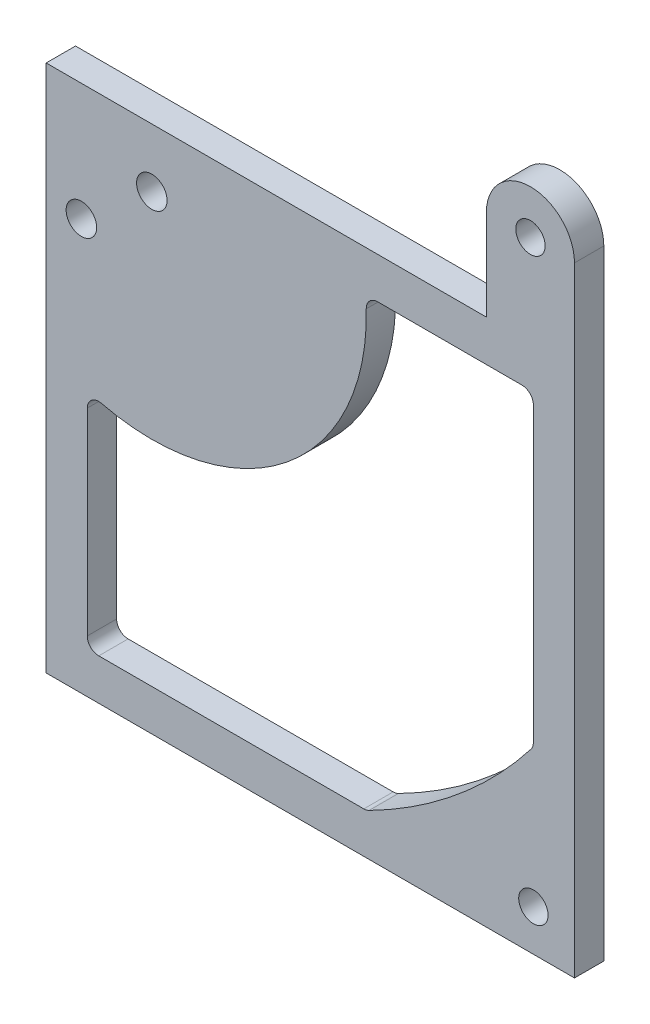
from build123d import *

# Parameters (mm, degrees)
SKETCH1_R           = 3.302
SKETCH1_R_2         = 3.175
BOSS_EXTRUDE1_DEPTH = 3.175


with BuildPart() as part:
    # Sketch1 → Boss-Extrude1 (new, symmetric)
    with BuildSketch(Plane.XY):
        with BuildLine():
            Line((-57.15, -57.15), (57.15, -57.15))
            Line((57.15, -57.15), (57.15, 76.835))
            ThreePointArc((57.15, 76.835), (47.625, 86.36), (38.1, 76.835))
            Line((38.1, 76.835), (38.1, 57.15))
            Line((38.1, 57.15), (-57.15, 57.15))
            Line((-57.15, 57.15), (-57.15, -57.15))
        make_face()
        with Locations((-49.53, 31.75)):
            Circle(SKETCH1_R, mode=Mode.SUBTRACT)
        with Locations((-34.29, 44.45)):
            Circle(SKETCH1_R, mode=Mode.SUBTRACT)
        with Locations((48.26, -48.25058611)):
            Circle(SKETCH1_R_2, mode=Mode.SUBTRACT)
        with Locations((47.625, 76.835)):
            Circle(SKETCH1_R_2, mode=Mode.SUBTRACT)
        with BuildLine():
            Line((-45.77152391, -48.25058611), (11.571822448, -48.25058611))
            ThreePointArc((11.571822448, -48.25058611), (12.151642643, -48.182093861), (12.69954516, -47.980387445))
            ThreePointArc((12.69954516, -47.980387445), (31.830233088, -35.421826409), (47.740202739, -18.972706629))
            ThreePointArc((47.740202739, -18.972706629), (48.126468012, -18.254805898), (48.26, -17.450597264))
            Line((48.26, -17.450597264), (48.26, 45.77152391))
            ThreePointArc((48.26, 45.77152391), (47.531142228, 47.531142228), (45.77152391, 48.26))
            Line((45.77152391, 48.26), (14.585930721, 48.26))
            ThreePointArc((14.585930721, 48.26), (12.802691065, 47.50719945), (12.09836376, 45.704264235))
            ThreePointArc((12.09836376, 45.704264235), (-5.096432418, 8.378001401), (-45.187165534, -0.657707262))
            ThreePointArc((-45.187165534, -0.657707262), (-47.310736599, -1.121263606), (-48.26, -3.076599268))
            Line((-48.26, -3.076599268), (-48.26, -45.76211002))
            ThreePointArc((-48.26, -45.76211002), (-47.531142228, -47.521728338), (-45.77152391, -48.25058611))
        make_face(mode=Mode.SUBTRACT)
    extrude(amount=BOSS_EXTRUDE1_DEPTH, both=True)


solid = part.part
